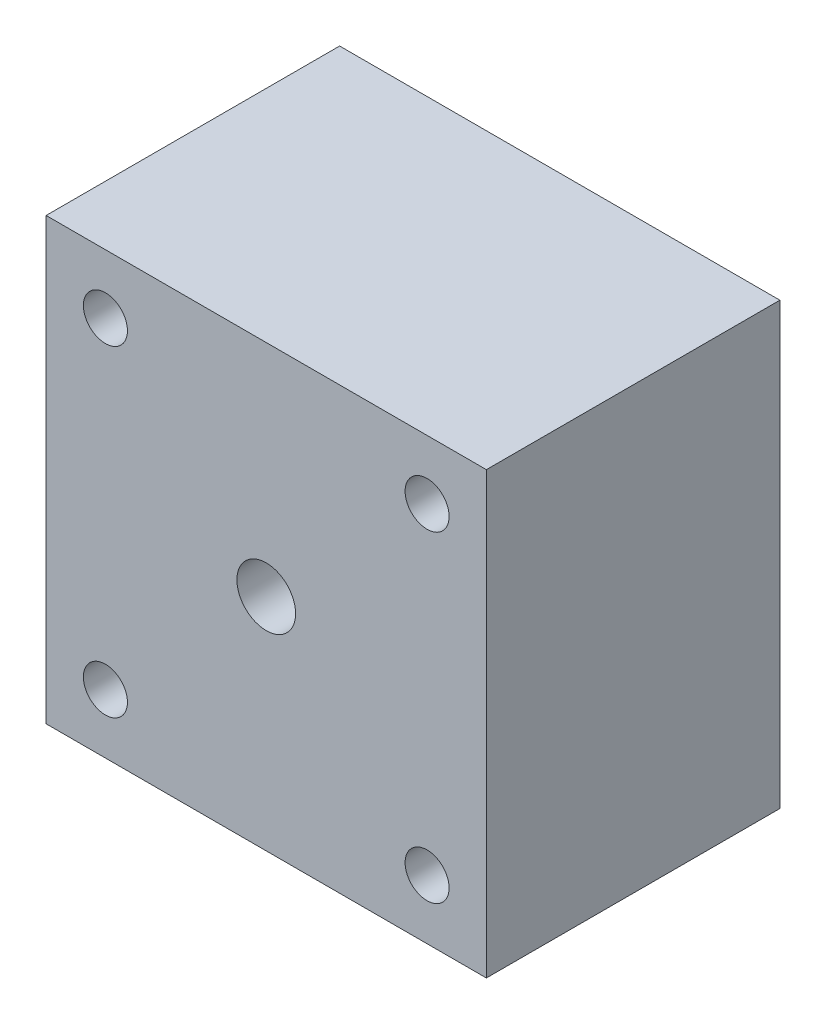
from build123d import *

# Parameters (mm, degrees)
SKETCH1_W           = 30
SKETCH1_H           = 30
SKETCH1_R           = 1.5
BOSS_EXTRUDE1_DEPTH = 20
SKETCH3_R           = 2
CUT_EXTRUDE1_DEPTH  = 10


with BuildPart() as part:
    # Sketch1 → Boss-Extrude1 (new body)
    with BuildSketch(Plane.XY):
        Rectangle(SKETCH1_W, SKETCH1_H)
        with Locations((10.960155108, 10.960155108)):
            Circle(SKETCH1_R, mode=Mode.SUBTRACT)
        with Locations((-10.960155108, 10.960155108)):
            Circle(SKETCH1_R, mode=Mode.SUBTRACT)
        with Locations((-10.960155108, -10.960155108)):
            Circle(SKETCH1_R, mode=Mode.SUBTRACT)
        with Locations((10.960155108, -10.960155108)):
            Circle(SKETCH1_R, mode=Mode.SUBTRACT)
    extrude(amount=BOSS_EXTRUDE1_DEPTH)

    # Sketch3 → Cut-Extrude1 (cut)
    with BuildSketch(Plane.XY.offset(20)):
        Circle(SKETCH3_R)
    extrude(amount=-CUT_EXTRUDE1_DEPTH, mode=Mode.SUBTRACT)


solid = part.part
